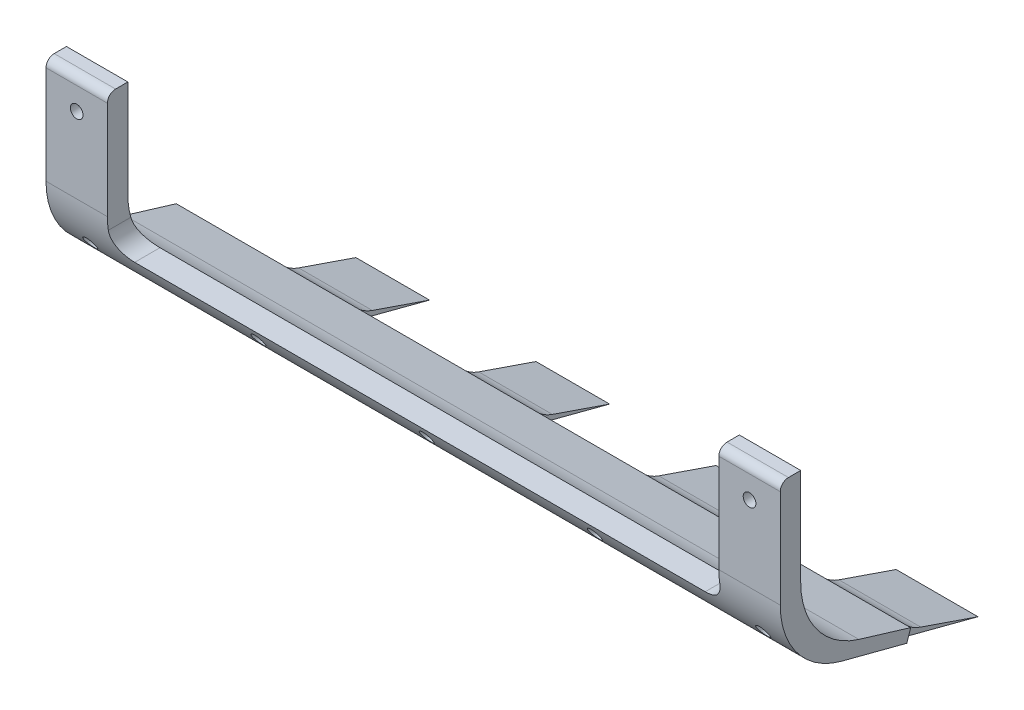
from build123d import *

# Parameters (mm, degrees)
BOSS_EXTRUDE1_DEPTH = 179.4
FILLET3_R           = 20
SKETCH3_W           = 149.4
SKETCH3_H           = 34
CUT_EXTRUDE2_DEPTH  = 90
FILLET5_R           = 5
CUT_EXTRUDE3_REACH  = 192.453
SKETCH4_R           = 1.55
SKETCH6_R           = 1.55
CUT_EXTRUDE4_DEPTH  = 90
CUT_EXTRUDE5_REACH  = 193.382
SKETCH10_W          = 2
SKETCH10_H          = 20
SKETCH10_W_2        = 26
FILLET7_R           = 2
FILLET8_R           = 10


with BuildPart() as part:
    # Sketch1 → Boss-Extrude1 (new body)
    with BuildSketch(Plane(origin=(0, 0, 0), x_dir=(0, 0, -1), z_dir=(1, 0, 0))):
        Polygon((-2.5, 9.511364154), (-2.5, -31.932011519), (47.815237798, -45.107221082), (28.890147616, -38.602329463), (29.328705173, -37.167872329), (2.5, -29.045260173), (2.5, 9.511364154), align=None)
    extrude(amount=BOSS_EXTRUDE1_DEPTH)

    # Fillet3
    fillet3_edges = [part.edges().sort_by_distance(p)[0] for p in [
        (89.7, -29.045260173, -2.5),
        (89.7, -31.932011519, 2.5),
    ]]
    fillet(fillet3_edges, radius=FILLET3_R)

    # Sketch3 → Cut-Extrude2 (cut, symmetric)
    with BuildSketch(Plane(origin=(0, 0, -2.5), x_dir=(-1, 0, 0), z_dir=(0, 0, -1))):
        with Locations((-89.7, -7.488635846)):
            Rectangle(SKETCH3_W, SKETCH3_H)
    extrude(amount=CUT_EXTRUDE2_DEPTH, both=True, mode=Mode.SUBTRACT)

    # Fillet5
    fillet5_edges = [part.edges().sort_by_distance(p)[0] for p in [
        (164.4, -24.488635846, -2.257029345),
        (15, -24.488635846, -2.257029345),
    ]]
    fillet(fillet5_edges, radius=FILLET5_R)

    # Sketch4 → Cut-Extrude3 (cut, up to next)
    with BuildSketch(Plane(origin=(0, 0, -2.5), x_dir=(-1, 0, 0), z_dir=(0, 0, -1)), mode=Mode.PRIVATE) as cut_extrude3_sk1:
        with Locations(Location((-171.9, 2.011364154, 0), (0, 0, 90))):
            Circle(SKETCH4_R)
    cut_extrude3_tool1 = extrude(cut_extrude3_sk1.sketch, amount=-CUT_EXTRUDE3_REACH, mode=Mode.PRIVATE) & part.part
    # Sketch4 → Cut-Extrude3 (cut, up to next)
    with BuildSketch(Plane(origin=(0, 0, -2.5), x_dir=(-1, 0, 0), z_dir=(0, 0, -1)), mode=Mode.PRIVATE) as cut_extrude3_sk2:
        with Locations(Location((-7.5, 2.011364154, 0), (0, 0, 90))):
            Circle(SKETCH4_R)
    cut_extrude3_tool2 = extrude(cut_extrude3_sk2.sketch, amount=-CUT_EXTRUDE3_REACH, mode=Mode.PRIVATE) & part.part
    add(cut_extrude3_tool1.solids().sort_by_distance((171.9, 2.011364, -2.5))[0], mode=Mode.SUBTRACT)
    add(cut_extrude3_tool2.solids().sort_by_distance((7.5, 2.011364, -2.5))[0], mode=Mode.SUBTRACT)

    # Sketch6 → Cut-Extrude4 (cut, symmetric)
    with BuildSketch(Plane(origin=(0, 0, -2.5), x_dir=(-1, 0, 0), z_dir=(0, 0, -1))):
        with Locations(Location((-171.9, -27.488635846, 0), (0, 0, 90))):
            Circle(SKETCH6_R)
        with Locations(Location((-130.8, -27.488635846, 0), (0, 0, 90))):
            Circle(SKETCH6_R)
        with Locations(Location((-89.7, -27.488635846, 0), (0, 0, 90))):
            Circle(SKETCH6_R)
        with Locations(Location((-48.6, -27.488635846, 0), (0, 0, 90))):
            Circle(SKETCH6_R)
        with Locations(Location((-7.5, -27.488635846, 0), (0, 0, 90))):
            Circle(SKETCH6_R)
    extrude(amount=CUT_EXTRUDE4_DEPTH, both=True, mode=Mode.SUBTRACT)

    # Sketch10 → Cut-Extrude5 (cut, up to next)
    with BuildSketch(Plane(origin=(0, -25.642780871, 8.81388193), x_dir=(1, 0, 0), z_dir=(0, 0.9456959410837774, -0.3250525911566754)), mode=Mode.PRIVATE) as cut_extrude5_sk1:
        with Locations((178.4, 49.8808954)):
            Rectangle(SKETCH10_W, SKETCH10_H)
    cut_extrude5_tool1 = extrude(cut_extrude5_sk1.sketch, amount=-CUT_EXTRUDE5_REACH, mode=Mode.PRIVATE) & part.part
    # Sketch10 → Cut-Extrude5 (cut, up to next)
    with BuildSketch(Plane(origin=(0, -25.642780871, 8.81388193), x_dir=(1, 0, 0), z_dir=(0, 0.9456959410837774, -0.3250525911566754)), mode=Mode.PRIVATE) as cut_extrude5_sk2:
        with Locations((144.4, 49.8808954)):
            Rectangle(SKETCH10_W_2, SKETCH10_H)
    cut_extrude5_tool2 = extrude(cut_extrude5_sk2.sketch, amount=-CUT_EXTRUDE5_REACH, mode=Mode.PRIVATE) & part.part
    # Sketch10 → Cut-Extrude5 (cut, up to next)
    with BuildSketch(Plane(origin=(0, -25.642780871, 8.81388193), x_dir=(1, 0, 0), z_dir=(0, 0.9456959410837774, -0.3250525911566754)), mode=Mode.PRIVATE) as cut_extrude5_sk3:
        with Locations((100.4, 49.8808954)):
            Rectangle(SKETCH10_W_2, SKETCH10_H)
    cut_extrude5_tool3 = extrude(cut_extrude5_sk3.sketch, amount=-CUT_EXTRUDE5_REACH, mode=Mode.PRIVATE) & part.part
    # Sketch10 → Cut-Extrude5 (cut, up to next)
    with BuildSketch(Plane(origin=(0, -25.642780871, 8.81388193), x_dir=(1, 0, 0), z_dir=(0, 0.9456959410837774, -0.3250525911566754)), mode=Mode.PRIVATE) as cut_extrude5_sk4:
        with Locations((56.4, 49.8808954)):
            Rectangle(SKETCH10_W_2, SKETCH10_H)
    cut_extrude5_tool4 = extrude(cut_extrude5_sk4.sketch, amount=-CUT_EXTRUDE5_REACH, mode=Mode.PRIVATE) & part.part
    # Sketch10 → Cut-Extrude5 (cut, up to next)
    with BuildSketch(Plane(origin=(0, -25.642780871, 8.81388193), x_dir=(1, 0, 0), z_dir=(0, 0.9456959410837774, -0.3250525911566754)), mode=Mode.PRIVATE) as cut_extrude5_sk5:
        with Locations((12.4, 49.8808954)):
            Rectangle(SKETCH10_W_2, SKETCH10_H)
    cut_extrude5_tool5 = extrude(cut_extrude5_sk5.sketch, amount=-CUT_EXTRUDE5_REACH, mode=Mode.PRIVATE) & part.part
    add(cut_extrude5_tool1.solids().sort_by_distance((178.4, -41.856695, -38.358278))[0], mode=Mode.SUBTRACT)
    add(cut_extrude5_tool2.solids().sort_by_distance((144.4, -41.856695, -38.358278))[0], mode=Mode.SUBTRACT)
    add(cut_extrude5_tool3.solids().sort_by_distance((100.4, -41.856695, -38.358278))[0], mode=Mode.SUBTRACT)
    add(cut_extrude5_tool4.solids().sort_by_distance((56.4, -41.856695, -38.358278))[0], mode=Mode.SUBTRACT)
    add(cut_extrude5_tool5.solids().sort_by_distance((12.4, -41.856695, -38.358278))[0], mode=Mode.SUBTRACT)

    # Fillet7
    fillet7_edges = [part.edges().sort_by_distance(p)[0] for p in [
        (171.9, 9.511364154, 2.5),
        (7.5, 9.511364154, 2.5),
    ]]
    fillet(fillet7_edges, radius=FILLET7_R)

    # Fillet8
    # the kernel refuses this fillet: 10 mm, written as the material it adds along each edge
    with BuildSketch(Plane(origin=(0, -38.602329463, -28.890147616), x_dir=(0, -0.32505259115667506, -0.9456959410837774), z_dir=(1, 0, 0))) as fillet8_piece_1_section:
        with BuildLine():
            CenterArc((5.214865983, 10), FILLET8_R, 238.221301226, 31.778698774)
            Line((-0.051531907, 1.49911456), (0, 0))
            Line((0, 0), (5.214865983, 0))
        make_face()
    fillet8_piece_1 = extrude(amount=179.4, mode=Mode.PRIVATE)
    fillet8_piece_1 = split(fillet8_piece_1, bisect_by=Plane(origin=(0, -38.606169259, -28.901318976), z_dir=(0, 0.3250525911566754, 0.9456959410837774)), keep=Keep.TOP, mode=Mode.PRIVATE)
    add(fillet8_piece_1)
    with BuildSketch(Plane(origin=(-13.037164957, -38.602329463, -28.890147616), x_dir=(0, -0.32505259115667506, -0.9456959410837774), z_dir=(1, 0, 0))) as fillet8_piece_2_section:
        with BuildLine():
            CenterArc((5.214865983, 10), FILLET8_R, 238.221301226, 31.778698774)
            Line((-0.051531907, 1.49911456), (0, 0))
            Line((0, 0), (5.214865983, 0))
        make_face()
    fillet8_piece_2 = extrude(amount=205.474329913, mode=Mode.PRIVATE)
    fillet8_piece_2 = split(fillet8_piece_2, bisect_by=Plane(origin=(25.4, -38.602329463, -28.890147616), z_dir=(1, 0, 0)), keep=Keep.TOP, mode=Mode.PRIVATE)
    fillet8_piece_2 = split(fillet8_piece_2, bisect_by=Plane(origin=(43.4, -38.602329463, -28.890147616), z_dir=(-1, 0, 0)), keep=Keep.TOP, mode=Mode.PRIVATE)
    add(fillet8_piece_2)
    with BuildSketch(Plane(origin=(-13.037164957, -38.602329463, -28.890147616), x_dir=(0, -0.32505259115667506, -0.9456959410837774), z_dir=(1, 0, 0))) as fillet8_piece_3_section:
        with BuildLine():
            CenterArc((5.214865983, 10), FILLET8_R, 238.221301226, 31.778698774)
            Line((-0.051531907, 1.49911456), (0, 0))
            Line((0, 0), (5.214865983, 0))
        make_face()
    fillet8_piece_3 = extrude(amount=205.474329913, mode=Mode.PRIVATE)
    fillet8_piece_3 = split(fillet8_piece_3, bisect_by=Plane(origin=(69.4, -38.602329463, -28.890147616), z_dir=(1, 0, 0)), keep=Keep.TOP, mode=Mode.PRIVATE)
    fillet8_piece_3 = split(fillet8_piece_3, bisect_by=Plane(origin=(87.4, -38.602329463, -28.890147616), z_dir=(-1, 0, 0)), keep=Keep.TOP, mode=Mode.PRIVATE)
    add(fillet8_piece_3)
    with BuildSketch(Plane(origin=(-13.037164957, -38.602329463, -28.890147616), x_dir=(0, -0.32505259115667506, -0.9456959410837774), z_dir=(1, 0, 0))) as fillet8_piece_4_section:
        with BuildLine():
            CenterArc((5.214865983, 10), FILLET8_R, 238.221301226, 31.778698774)
            Line((-0.051531907, 1.49911456), (0, 0))
            Line((0, 0), (5.214865983, 0))
        make_face()
    fillet8_piece_4 = extrude(amount=205.474329913, mode=Mode.PRIVATE)
    fillet8_piece_4 = split(fillet8_piece_4, bisect_by=Plane(origin=(113.4, -38.602329463, -28.890147616), z_dir=(1, 0, 0)), keep=Keep.TOP, mode=Mode.PRIVATE)
    fillet8_piece_4 = split(fillet8_piece_4, bisect_by=Plane(origin=(131.4, -38.602329463, -28.890147616), z_dir=(-1, 0, 0)), keep=Keep.TOP, mode=Mode.PRIVATE)
    add(fillet8_piece_4)
    with BuildSketch(Plane(origin=(-13.037164957, -38.602329463, -28.890147616), x_dir=(0, -0.32505259115667506, -0.9456959410837774), z_dir=(1, 0, 0))) as fillet8_piece_5_section:
        with BuildLine():
            CenterArc((5.214865983, 10), FILLET8_R, 238.221301226, 31.778698774)
            Line((-0.051531907, 1.49911456), (0, 0))
            Line((0, 0), (5.214865983, 0))
        make_face()
    fillet8_piece_5 = extrude(amount=205.474329913, mode=Mode.PRIVATE)
    fillet8_piece_5 = split(fillet8_piece_5, bisect_by=Plane(origin=(157.4, -38.602329463, -28.890147616), z_dir=(1, 0, 0)), keep=Keep.TOP, mode=Mode.PRIVATE)
    fillet8_piece_5 = split(fillet8_piece_5, bisect_by=Plane(origin=(177.4, -38.602329463, -28.890147616), z_dir=(-1, 0, 0)), keep=Keep.TOP, mode=Mode.PRIVATE)
    add(fillet8_piece_5)


solid = part.part
